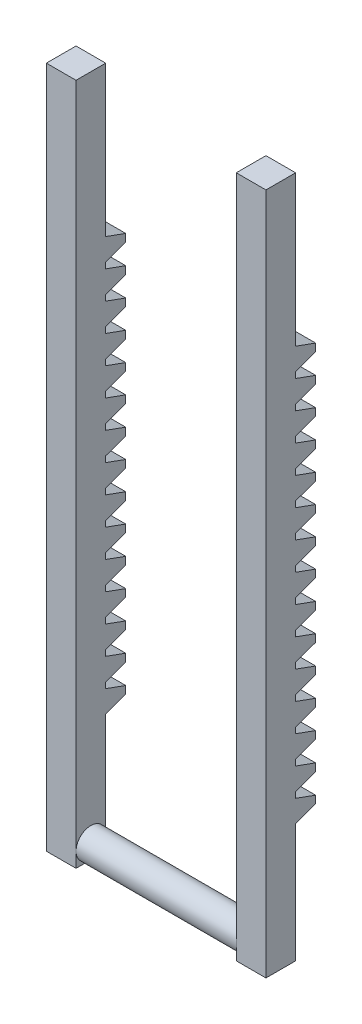
from build123d import *

# Parameters (mm, degrees)
SKETCH_1_W             = 5
SKETCH_1_H             = 5
EXTRUDE_2_DEPTH        = 115
EXTRUDE_2_2_DEPTH      = 115
SKETCH_2_R             = 2.5
EXTRUDE_3_DEPTH        = 27
EXTRUDE_5_DEPTH        = 5
PATTERN_LINEAR_1_COUNT = 15
PATTERN_LINEAR_1_PITCH = 4.71238898
EXTRUDE_6_DEPTH        = 5
PATTERN_LINEAR_2_COUNT = 15
PATTERN_LINEAR_2_PITCH = 4.712


with BuildPart() as part:
    # ｽｹｯﾁ1 → ﾎﾞｽ - 押し出し2 (new body)
    with BuildSketch(Plane(origin=(0, 0, 0), x_dir=(1, 0, 0), z_dir=(0, 1, 0))):
        with Locations((-18.035714286, 2.5)):
            Rectangle(SKETCH_1_W, SKETCH_1_H)
    extrude(amount=-EXTRUDE_2_DEPTH)



with BuildPart() as body_2:
    # ｽｹｯﾁ1 → Extrude 2 2 (new body)
    with BuildSketch(Plane(origin=(0, 0, 0), x_dir=(1, 0, 0), z_dir=(0, 1, 0))):
        with Locations((13.964285714, 2.5)):
            Rectangle(SKETCH_1_W, SKETCH_1_H)
    extrude(amount=-EXTRUDE_2_2_DEPTH)


with BuildPart() as part_1:
    add(part.part)

    add(body_2.part)  # ﾎﾞｽ - 押し出し3 merges body 2
    # ｽｹｯﾁ2 → ﾎﾞｽ - 押し出し3 (add)
    with BuildSketch(Plane(origin=(-15.535714286, 0, 0), x_dir=(0, 0, -1), z_dir=(1, 0, 0))):
        with Locations((2.5, -112.5)):
            Circle(SKETCH_2_R)
    extrude(amount=EXTRUDE_3_DEPTH)

    # ｽｹｯﾁ3 → ﾎﾞｽ - 押し出し5 (add)
    with BuildSketch(Plane(origin=(16.464285714, 0, 0), x_dir=(0, 0, -1), z_dir=(1, 0, 0))):
        Polygon((5, -91.278917131), (8.375, -92.507316672), (8.375, -93.771600459), (5, -95), align=None)
    extrude_5 = extrude(amount=-EXTRUDE_5_DEPTH)

    # 直線ﾊﾟﾀｰﾝ1: ﾎﾞｽ - 押し出し5 ×15
    with Locations(*[(0, i * PATTERN_LINEAR_1_PITCH, 0) for i in range(1, PATTERN_LINEAR_1_COUNT)]):
        add(extrude_5)

    # ｽｹｯﾁ4 → ﾎﾞｽ - 押し出し6 (add)
    with BuildSketch(Plane.ZY.offset(20.535714286)):
        Polygon((-5, -25.305471406), (-8.375, -26.533870947), (-8.375, -27.798154734), (-5, -29.026554275), align=None)
    extrude_6 = extrude(amount=-EXTRUDE_6_DEPTH)

    # 直線ﾊﾟﾀｰﾝ2: ﾎﾞｽ - 押し出し6 ×15
    with Locations(*[(0, -i * PATTERN_LINEAR_2_PITCH, 0) for i in range(1, PATTERN_LINEAR_2_COUNT)]):
        add(extrude_6)


solid = part_1.part
